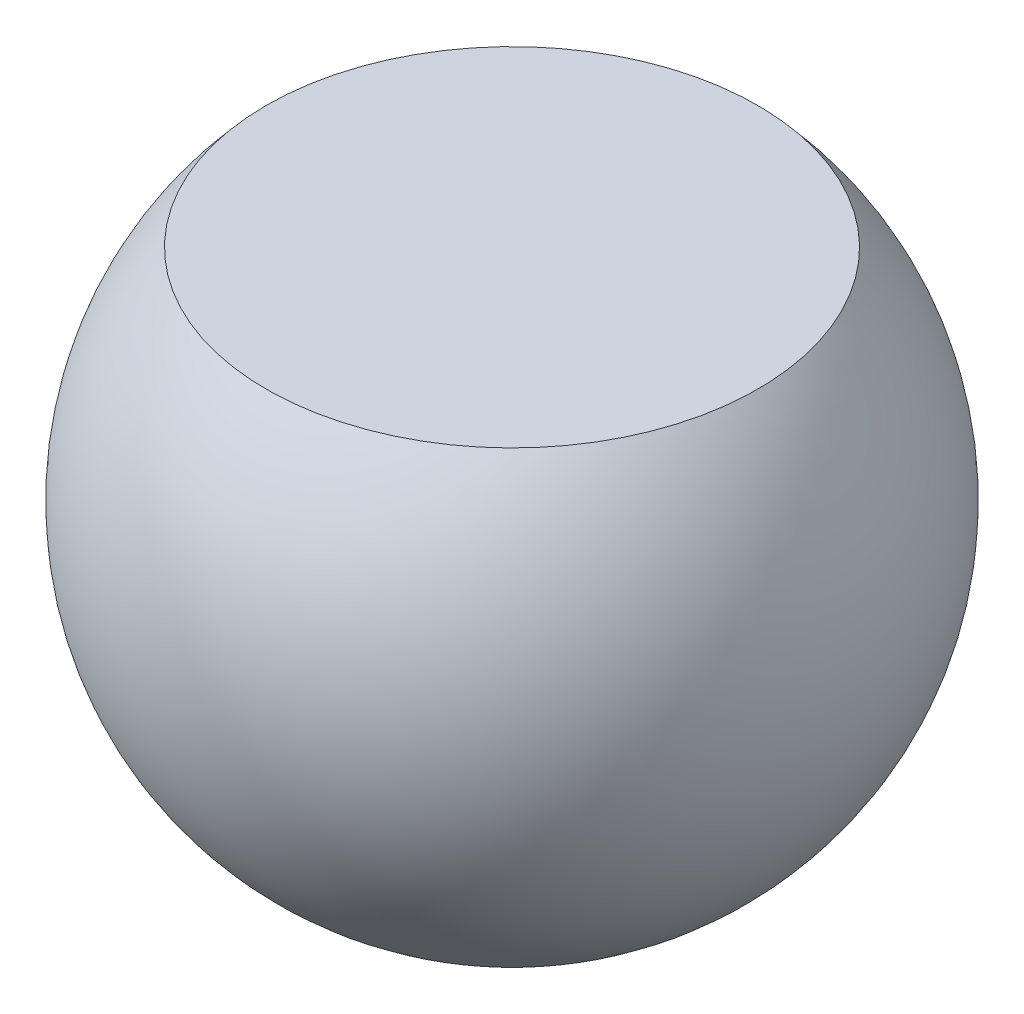
from build123d import *


with BuildPart() as part:
    # 草图1 → 旋转1 (revolve)
    with BuildSketch(Plane.XY):
        with BuildLine():
            Line((0, 6), (6.708203932, 6))
            ThreePointArc((6.708203932, 6), (8.215838363, -3.674234614), (0, -9))
            Line((0, -9), (0, 6))
        make_face()
    revolve(axis=Axis((0, 6, 0), (0, -1, 0)))


solid = part.part
